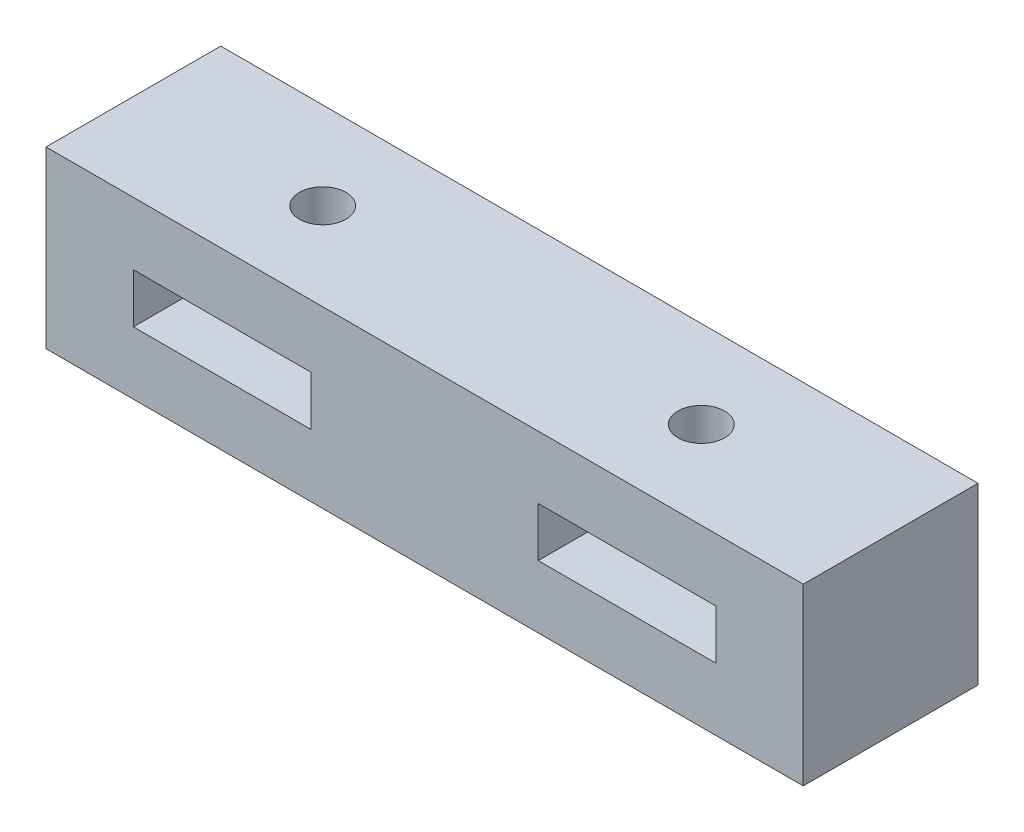
from build123d import *

# Parameters (mm, degrees)
CROQUIS1_W              = 52
CROQUIS1_H              = 12
CROQUIS1_W_2            = 12.2
CROQUIS1_H_2            = 3.4
SALIENTE_EXTRUIR1_DEPTH = 6
CROQUIS2_R              = 4.26875
CORTAR_EXTRUIR1_DEPTH   = 11
CROQUIS3_R              = 1.6
CORTAR_EXTRUIR2_DEPTH   = 30


with BuildPart() as part:
    # Croquis1 → Saliente-Extruir1 (new, symmetric)
    with BuildSketch(Plane.XY):
        Rectangle(CROQUIS1_W, CROQUIS1_H)
        with Locations((13.9, 0)):
            Rectangle(CROQUIS1_W_2, CROQUIS1_H_2, mode=Mode.SUBTRACT)
        with Locations((-13.9, 0)):
            Rectangle(CROQUIS1_W_2, CROQUIS1_H_2, mode=Mode.SUBTRACT)
    extrude(amount=SALIENTE_EXTRUIR1_DEPTH, both=True)

    # Croquis2 → Cortar-Extruir1 (cut)
    with BuildSketch(Plane(origin=(0, 0, -6), x_dir=(-1, 0, 0), z_dir=(0, 0, -1))):
        Circle(CROQUIS2_R)
    extrude(amount=-CORTAR_EXTRUIR1_DEPTH, mode=Mode.SUBTRACT)

    # Croquis3 → Cortar-Extruir2 (cut)
    with BuildSketch(Plane(origin=(0, 6, 0), x_dir=(1, 0, 0), z_dir=(0, 1, 0))):
        with Locations((-13, 0)):
            Circle(CROQUIS3_R)
        with Locations((13, 0)):
            Circle(CROQUIS3_R)
    extrude(amount=-CORTAR_EXTRUIR2_DEPTH, mode=Mode.SUBTRACT)


solid = part.part
